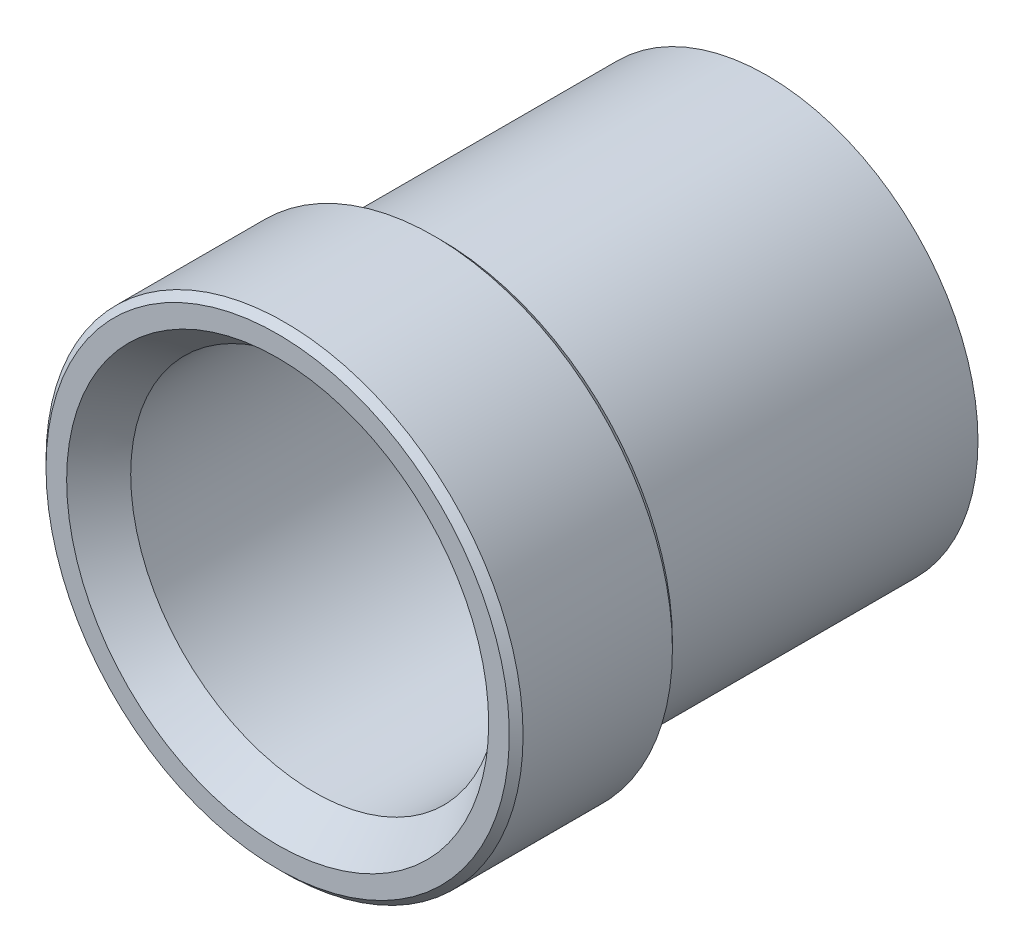
from build123d import *

# Parameters (mm, degrees)
CHAMFER1_SIZE = 0.17859375


with BuildPart() as part:
    # Sketch2 → Revolve1 (revolve)
    with BuildSketch(Plane(origin=(0, 0, 0), x_dir=(0, 0, -1), z_dir=(1, 0, 0))):
        Polygon((-5.401992356, 4.7625), (-6.35, 5.476875), (-6.35, 6.19125), (-2.116666667, 6.19125), (-2.116666667, 5.476875), (6.35, 5.476875), (6.35, 4.7625), align=None)
    revolve(axis=Axis((0, 0, 6.35), (0, 0, -1)))

    # Chamfer1
    chamfer1_edges = [part.edges().sort_by_distance(p)[0] for p in [
        (0, -6.19125, 6.35),
        (0, -6.19125, 2.116666667),
    ]]
    chamfer(chamfer1_edges, length=CHAMFER1_SIZE)


solid = part.part
